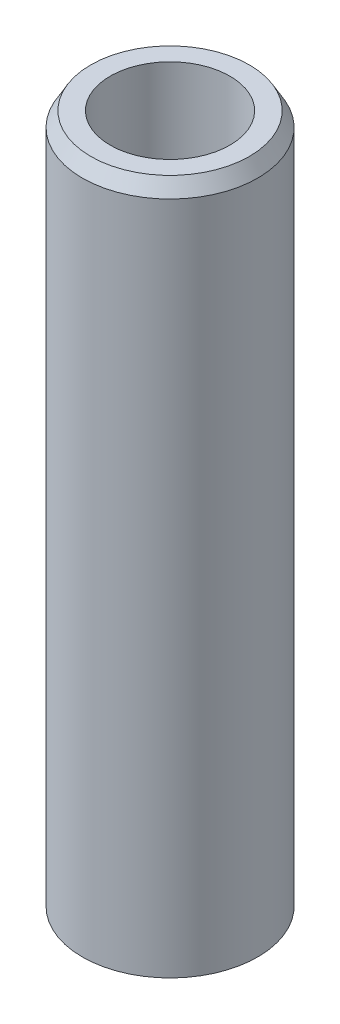
from build123d import *
from OCP.BRepFilletAPI import BRepFilletAPI_MakeChamfer

# Parameters (mm, degrees)
SKETCH1_R           = 32.5
BOSS_EXTRUDE1_DEPTH = 258.423691141
SKETCH2_R           = 22.172016468
CUT_EXTRUDE1_DEPTH  = 263.47914992
CHAMFER1_SIZE       = 5.391616157
CHAMFER1_SIZE2      = 3.11285104


with BuildPart() as part:
    # Sketch1 → Boss-Extrude1 (new body)
    with BuildSketch(Plane(origin=(0, 0, 0), x_dir=(1, 0, 0), z_dir=(0, 1, 0))):
        Circle(SKETCH1_R)
    extrude(amount=BOSS_EXTRUDE1_DEPTH)

    # Sketch2 → Cut-Extrude1 (cut, through all)
    with BuildSketch(Plane(origin=(0, 0, 0), x_dir=(1, 0, 0), z_dir=(0, 1, 0))):
        Circle(SKETCH2_R)
    extrude(amount=CUT_EXTRUDE1_DEPTH, mode=Mode.SUBTRACT)

    # Chamfer1: one chamfer whose edges measure the first distance from different faces: ONE call of the kernel's chamfer builder (chamfer() names one face for all edges)
    chamfer1_edges_1 = [part.edges().sort_by_distance(p)[0] for p in [
        (-32.5, 258.423691141, 0),
    ]]
    chamfer1_side_1 = [part.faces().sort_by_distance(p)[0] for p in [
        (-32.5, 129.21184557, 0),
    ]]
    chamfer1_edges_2 = [part.edges().sort_by_distance(p)[0] for p in [
        (-32.5, 0, 0),
    ]]
    chamfer1_side_2 = [part.faces().sort_by_distance(p)[0] for p in [
        (-31.580761184, 0, 0),
    ]]
    chamfer1 = BRepFilletAPI_MakeChamfer(part.part.solid().wrapped)
    for e in chamfer1_edges_1:
        chamfer1.Add(CHAMFER1_SIZE, CHAMFER1_SIZE2, e.wrapped, chamfer1_side_1[0].wrapped)  # the first distance lies on this face
    for e in chamfer1_edges_2:
        chamfer1.Add(CHAMFER1_SIZE, CHAMFER1_SIZE2, e.wrapped, chamfer1_side_2[0].wrapped)  # the first distance lies on this face
    add(Compound.cast(chamfer1.Shape()), mode=Mode.REPLACE)


solid = part.part
